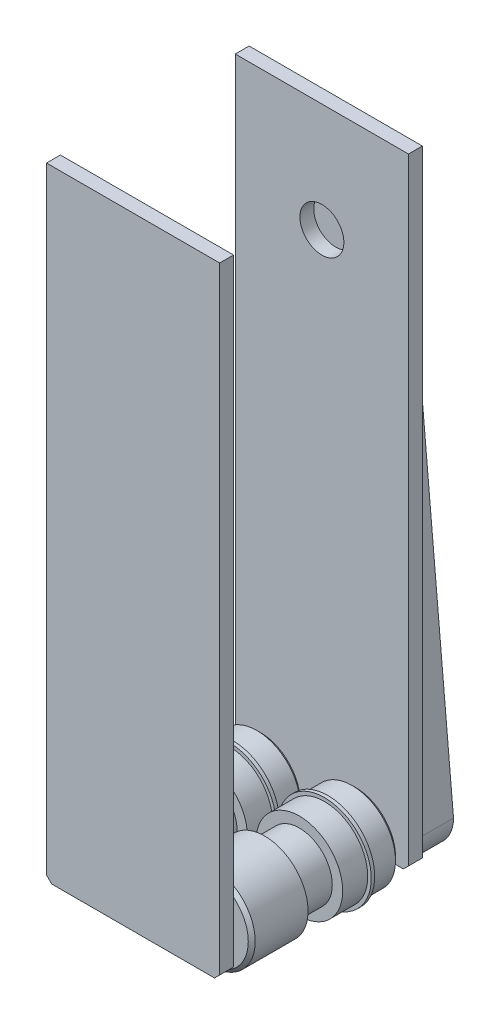
from build123d import *

# Parameters (mm, degrees)
SKETCH_1_R          = 25
EXTRUDE_1_DEPTH     = 42.5
EXTRUDE_1_2_DEPTH   = 42.5
SKETCH_2_R          = 25
SKETCH_2_R_2        = 19
CUT_EXTRUDE_1_DEPTH = 10
CHAMFER_1_SIZE      = 2
SKETCH_3_R          = 5
EXTRUDE_2_DEPTH     = 8
SKETCH_4_W          = 100
SKETCH_4_H          = 359
EXTRUDE_3_DEPTH     = 8
CHAMFER_2_SIZE      = 3
EXTRUDE_START       = 22
SKETCH_5_R          = 19
EXTRUDE_4_DEPTH     = 22
SKETCH_7_R          = 12.691244745
CUT_EXTRUDE_2_DEPTH = 10
SKETCH_8_R          = 19
EXTRUDE_5_DEPTH     = 20
EXTRUDE_6_DEPTH     = 20
CHAMFER_3_SIZE      = 2
CHAMFER_4_SIZE      = 2
SKETCH_11_R         = 27
EXTRUDE_8_DEPTH     = 2


with BuildPart() as part:
    # 草图1 → 凸台-拉伸1 (new, symmetric)
    with BuildSketch(Plane.XY):
        with Locations((-27.5, 0)):
            Circle(SKETCH_1_R)
    extrude(amount=EXTRUDE_1_DEPTH, both=True)


with BuildPart() as body_2:
    # 草图1 → Extrude 1 2 (new, symmetric)
    with BuildSketch(Plane.XY):
        with Locations((27.5, 0)):
            Circle(SKETCH_1_R)
    extrude(amount=EXTRUDE_1_2_DEPTH, both=True)


with BuildPart() as cut_extrude_1_tool:
    # 草图2 → 切除-拉伸1 (new, symmetric)
    # profile 1 of 2: a face of its own
    with BuildSketch(Plane.XY):
        with Locations((-27.5, 0)):
            Circle(SKETCH_2_R)
        with Locations((-27.5, 0)):
            Circle(SKETCH_2_R_2, mode=Mode.SUBTRACT)
    # profile 2 of 2: a face of its own
    with BuildSketch(Plane.XY):
        with Locations((27.5, 0)):
            Circle(SKETCH_2_R)
        with Locations((27.5, 0)):
            Circle(SKETCH_2_R_2, mode=Mode.SUBTRACT)
    extrude(amount=CUT_EXTRUDE_1_DEPTH, both=True)


with BuildPart() as part_1:
    add(part.part)

    # 切除-拉伸1: cut by cut_extrude_1_tool
    add(cut_extrude_1_tool.part, mode=Mode.SUBTRACT)



with BuildPart() as body_2_1:
    add(body_2.part)

    # 切除-拉伸1: cut by cut_extrude_1_tool
    add(cut_extrude_1_tool.part, mode=Mode.SUBTRACT)

    # 倒角1
    chamfer_1_edges = [body_2_1.edges().sort_by_distance(p)[0] for p in [
        (2.5, 0, -42.5),
        (2.5, 0, 42.5),
    ]]
    chamfer(chamfer_1_edges, length=CHAMFER_1_SIZE)


with BuildPart() as part_2:
    add(part_1.part)

    add(body_2_1.part)  # 凸台-拉伸2 merges body 2
    # 草图3 → 凸台-拉伸2 (add)
    with BuildSketch(Plane(origin=(0, 0, -42.5), x_dir=(-1, 0, 0), z_dir=(0, 0, -1))):
        with Locations(Location((-27.5, 0, 0), (0, 0, 180))):
            Circle(SKETCH_3_R)
        with Locations(Location((27.5, 0, 0), (0, 0, 180))):
            Circle(SKETCH_3_R)
    extrude_2 = extrude(amount=EXTRUDE_2_DEPTH)

    # 镜向1: 凸台-拉伸2 across plane
    add(extrude_2.mirror(Plane.XY))

    # 草图4 → 凸台-拉伸3 (add)
    with BuildSketch(Plane(origin=(0, 0, -50.5), x_dir=(-1, 0, 0), z_dir=(0, 0, -1))):
        with Locations((0, 167.5)):
            Rectangle(SKETCH_4_W, SKETCH_4_H)
    extrude_3 = extrude(amount=EXTRUDE_3_DEPTH)

    # 镜向2: 凸台-拉伸3 across plane
    add(extrude_3.mirror(Plane.XY))

    # 倒角2
    chamfer_2_edges = [part_2.edges().sort_by_distance(p)[0] for p in [
        (50, -12, -54.5),
        (-50, -12, -54.5),
        (50, -12, 54.5),
        (-50, -12, 54.5),
    ]]
    chamfer(chamfer_2_edges, length=CHAMFER_2_SIZE)

    # 草图5 → 凸台-拉伸4 (add)
    with BuildSketch(Plane(origin=(0, 0, -58.5), x_dir=(-1, 0, 0), z_dir=(0, 0, -1)).offset(EXTRUDE_START)):
        with Locations(Location((27.5, 0, 0), (0, 0, 180))):
            Circle(SKETCH_5_R)
        with Locations(Location((-27.5, 0, 0), (0, 0, 180))):
            Circle(SKETCH_5_R)
    extrude(amount=-EXTRUDE_4_DEPTH)

    # 草图7 → 切除-拉伸2 (cut)
    with BuildSketch(Plane.XY.offset(-50.5)):
        with Locations((0, 284.128548052)):
            Circle(SKETCH_7_R)
    extrude(amount=-CUT_EXTRUDE_2_DEPTH, mode=Mode.SUBTRACT)

    # 草图8 → 凸台-拉伸5 (add)
    with BuildSketch(Plane(origin=(0, 0, -58.5), x_dir=(-1, 0, 0), z_dir=(0, 0, -1))):
        with Locations(Location((0, 284.128548052, 0), (0, 0, 180))):
            Circle(SKETCH_8_R)
    extrude(amount=EXTRUDE_5_DEPTH)

    # 草图9 → 凸台-拉伸6 (add)
    with BuildSketch(Plane(origin=(0, 0, -58.5), x_dir=(-1, 0, 0), z_dir=(0, 0, -1))):
        with BuildLine():
            Line((-47.663589703, 3.657187648), (-47.992568683, 0))
            ThreePointArc((-47.992568683, 0), (-41.99043428, -14.49043428), (-27.5, -20.492568683))
            Line((-27.5, -20.492568683), (-27.257396579, -20.491132589))
            Line((-27.257396579, -20.491132589), (27.5, -20.166995645))
            ThreePointArc((27.5, -20.166995645), (41.760219376, -14.260219376), (47.666995645, 0))
            Line((47.666995645, 0), (47.351318556, 3.554274177))
            Line((47.351318556, 3.554274177), (22.256216625, 286.105260405))
            ThreePointArc((22.256216625, 286.105260405), (0.012611737, 306.472370714), (-22.253970975, 286.130383715))
            Line((-22.253970975, 286.130383715), (-47.663589703, 3.657187648))
        make_face()
        with BuildLine():
            ThreePointArc((-19.514906453, 285.892832564), (-1.852338091, 303.635293483), (18.83403815, 289.534404199))
            Line((18.83403815, 289.534404199), (44.24481717, 3.429143794))
            ThreePointArc((44.24481717, 3.429143794), (40.523912674, -10.592577543), (27.5, -16.98253045))
            Line((27.5, -16.98253045), (-26.978378853, -17.781424905))
            ThreePointArc((-26.978378853, -17.781424905), (-27.239161385, -17.78716176), (-27.5, -17.789074183))
            ThreePointArc((-27.5, -17.789074183), (-41.187186564, -11.397239057), (-45.072256133, 3.200735692))
            Line((-45.072256133, 3.200735692), (-19.514906453, 285.892832564))
        make_face(mode=Mode.SUBTRACT)
    extrude(amount=EXTRUDE_6_DEPTH)

    # 倒角3
    chamfer_3_edges = [part_2.edges().sort_by_distance(p)[0] for p in [
        (-19, 284.128548052, -78.5),
        (-46.5, 0, -80.5),
        (8.5, 0, -80.5),
    ]]
    chamfer(chamfer_3_edges, length=CHAMFER_3_SIZE - 0.0001)  # a hair under: the kernel refuses the full size

    # 倒角4
    chamfer_4_edges = [part_2.edges().sort_by_distance(p)[0] for p in [
        (-52.5, 0, -42.5),
        (-52.5, 0, 42.5),
    ]]
    chamfer(chamfer_4_edges, length=CHAMFER_4_SIZE)

    # 草图11 → 凸台-拉伸8 (add)
    with BuildSketch(Plane(origin=(0, 0, -24.5), x_dir=(-1, 0, 0), z_dir=(0, 0, -1))):
        with Locations((27.5, 0)):
            Circle(SKETCH_11_R)
        with Locations((-27.5, 0)):
            Circle(SKETCH_11_R)
    extrude(amount=EXTRUDE_8_DEPTH)


solid = part_2.part
